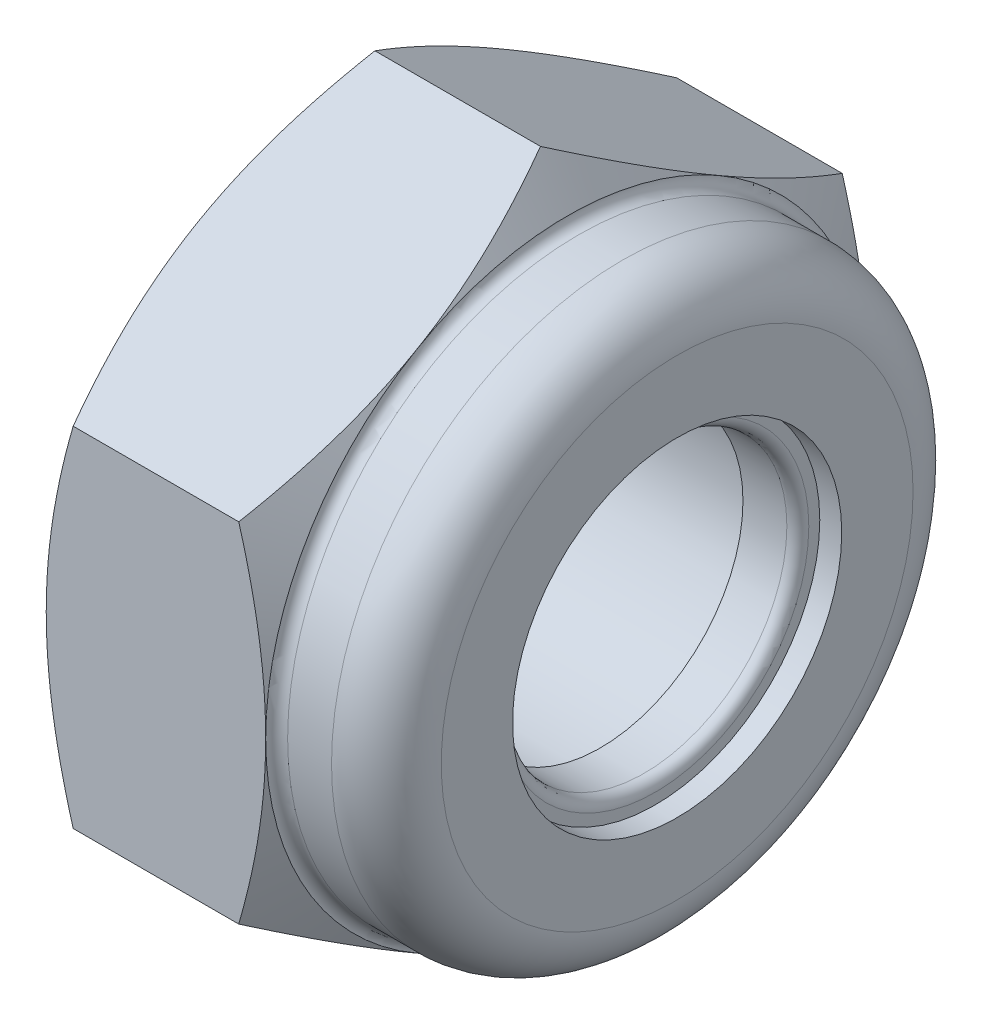
from build123d import *

# Parameters (mm, degrees)
SKETCH_1_R          = 1.5
EXTRUDE_1_DEPTH     = 2
SKETCH_2_OUTSIDE_W  = 16.156
SKETCH_2_OUTSIDE_H  = 17.006
SKETCH_2_OUTSIDE_R  = 2.75
CUT_EXTRUDE_1_DEPTH = 2
CUT_EXTRUDE_1_DRAFT = -60
SKETCH_3_OUTSIDE_W  = 16.156
SKETCH_3_OUTSIDE_H  = 17.006
SKETCH_3_OUTSIDE_R  = 2.75
CUT_EXTRUDE_2_DEPTH = 2
CUT_EXTRUDE_2_DRAFT = -60
SKETCH_4_R          = 2.65
SKETCH_4_R_2        = 1.5
EXTRUDE_2_DEPTH     = 1
FILLET_1_R          = 0.1
FILLET_2_R          = 0.5
EXTRUDE_START       = -0.2
SKETCH_5_R          = 1.7
SKETCH_5_R_2        = 1.3
EXTRUDE_3_DEPTH     = 0.5
FILLET_3_R          = 0.1


with BuildPart() as part:
    # 草图1 → 凸台-拉伸1 (new body)
    with BuildSketch(Plane(origin=(0, 0, 0), x_dir=(0, 0, -1), z_dir=(1, 0, 0))):
        Polygon((0, 3.175426481), (-2.75, 1.58771324), (-2.75, -1.58771324), (0, -3.175426481), (2.75, -1.58771324), (2.75, 1.58771324), align=None)
        Circle(SKETCH_1_R, mode=Mode.SUBTRACT)
    extrude(amount=EXTRUDE_1_DEPTH)


with BuildPart() as cut_extrude_1_tool:
    # 草图2 outside → 切除-拉伸1 (with draft: the straight prism first)
    with BuildSketch(Plane.ZY):
        Rectangle(SKETCH_2_OUTSIDE_W, SKETCH_2_OUTSIDE_H)
        Circle(SKETCH_2_OUTSIDE_R, mode=Mode.SUBTRACT)
    extrude(amount=-CUT_EXTRUDE_1_DEPTH)
    # 切除-拉伸1: the draft: its side faces are tilted about the plane it starts from
    cut_extrude_1_sides = [cut_extrude_1_tool.faces().sort_by_distance(p)[0] for p in [
        (1, -8.503, 0),
        (1, 0, 8.078),
        (1, 8.503, 0),
        (1, 0, -8.078),
        (1, 0, -2.75),
    ]]
    draft(cut_extrude_1_sides, Plane.ZY, CUT_EXTRUDE_1_DRAFT)


with BuildPart() as part_1:
    add(part.part)

    # 切除-拉伸1: cut by cut_extrude_1_tool
    add(cut_extrude_1_tool.part, mode=Mode.SUBTRACT)


with BuildPart() as cut_extrude_2_tool:
    # 草图3 outside → 切除-拉伸2 (with draft: the straight prism first)
    with BuildSketch(Plane(origin=(2, 0, 0), x_dir=(0, 0, -1), z_dir=(1, 0, 0))):
        Rectangle(SKETCH_3_OUTSIDE_W, SKETCH_3_OUTSIDE_H)
        Circle(SKETCH_3_OUTSIDE_R, mode=Mode.SUBTRACT)
    extrude(amount=-CUT_EXTRUDE_2_DEPTH)
    # 切除-拉伸2: the draft: its side faces are tilted about the plane it starts from
    cut_extrude_2_sides = [cut_extrude_2_tool.faces().sort_by_distance(p)[0] for p in [
        (1, -8.503, 0),
        (1, 0, -8.078),
        (1, 8.503, 0),
        (1, 0, 8.078),
        (1, 0, 2.75),
    ]]
    draft(cut_extrude_2_sides, Plane(origin=(2, 0, 0), x_dir=(0, 0, -1), z_dir=(1, 0, 0)), CUT_EXTRUDE_2_DRAFT)


with BuildPart() as part_2:
    add(part_1.part)

    # 切除-拉伸2: cut by cut_extrude_2_tool
    add(cut_extrude_2_tool.part, mode=Mode.SUBTRACT)

    # 草图4 → 凸台-拉伸2 (add)
    with BuildSketch(Plane(origin=(2, 0, 0), x_dir=(0, 0, -1), z_dir=(1, 0, 0))):
        Circle(SKETCH_4_R)
        Circle(SKETCH_4_R_2, mode=Mode.SUBTRACT)
    extrude(amount=EXTRUDE_2_DEPTH)

    # 圆角1
    fillet_1_edges = [part_2.edges().sort_by_distance(p)[0] for p in [
        (2, 0, 2.65),
    ]]
    fillet(fillet_1_edges, radius=FILLET_1_R - 0.0001)  # a hair under: the kernel refuses the full size

    # 圆角2
    fillet_2_edges = [part_2.edges().sort_by_distance(p)[0] for p in [
        (3, 0, 2.65),
    ]]
    fillet(fillet_2_edges, radius=FILLET_2_R)

    # 草图5 → 凸台-拉伸3 (add)
    with BuildSketch(Plane(origin=(3, 0, 0), x_dir=(0, 0, -1), z_dir=(1, 0, 0)).offset(EXTRUDE_START)):
        Circle(SKETCH_5_R)
        Circle(SKETCH_5_R_2, mode=Mode.SUBTRACT)
    extrude(amount=-EXTRUDE_3_DEPTH)

    # 圆角3
    fillet_3_edges = [part_2.edges().sort_by_distance(p)[0] for p in [
        (2.8, 0, 1.3),
    ]]
    fillet(fillet_3_edges, radius=FILLET_3_R)


solid = part_2.part
